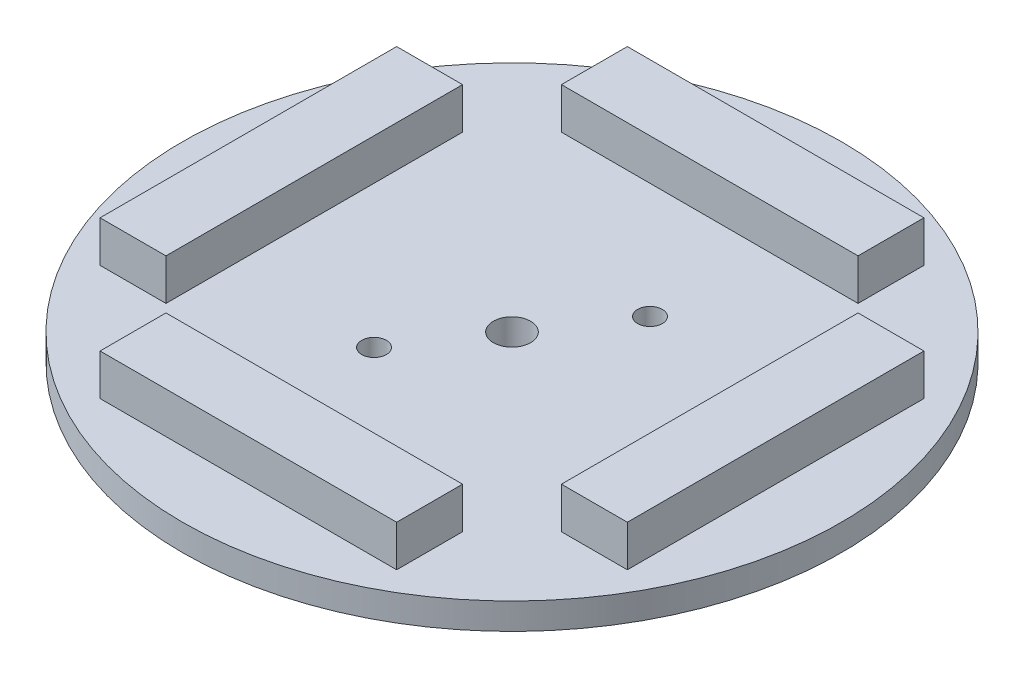
from build123d import *

# Parameters (mm, degrees)
SKETCH1_R                    = 20
SKETCH1_R_2                  = 1.1303
SKETCH1_R_3                  = 0.75
PCB_DEPTH                    = 1.6
SKETCH2_W                    = 18
SKETCH2_H                    = 4
HIROSE_CONNECTOR_STACK_DEPTH = 2.5
CIRPATTERN1_COUNT            = 4


with BuildPart() as part:
    # Sketch1 → PCB (new body)
    with BuildSketch(Plane(origin=(0, 0, 0), x_dir=(1, 0, 0), z_dir=(0, 1, 0))):
        Circle(SKETCH1_R)
        Circle(SKETCH1_R_2, mode=Mode.SUBTRACT)
        with Locations((3.372542584, 5)):
            Circle(SKETCH1_R_3, mode=Mode.SUBTRACT)
        with Locations((-3.372542584, -5)):
            Circle(SKETCH1_R_3, mode=Mode.SUBTRACT)
    extrude(amount=PCB_DEPTH)

    # Sketch2 → Hirose Connector Stack (add)
    with BuildSketch(Plane(origin=(0, 1.6, 0), x_dir=(1, 0, 0), z_dir=(0, 1, 0))):
        with Locations((0, 14)):
            Rectangle(SKETCH2_W, SKETCH2_H)
    hirose_connector_stack = extrude(amount=HIROSE_CONNECTOR_STACK_DEPTH)

    # CirPattern1: Hirose Connector Stack ×4 about axis
    cirpattern1_axis = Axis((0, 1.6, 0), (0, 1, 0))
    for i in range(1, CIRPATTERN1_COUNT):
        add(hirose_connector_stack.rotate(cirpattern1_axis, i * 360 / CIRPATTERN1_COUNT))


solid = part.part
